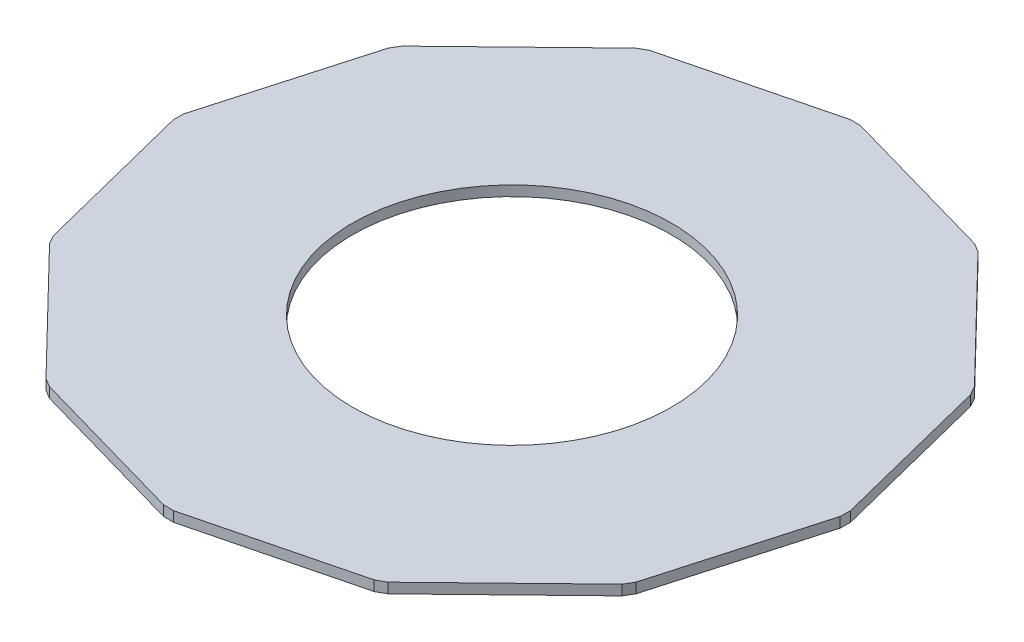
from build123d import *

# Parameters (mm, degrees)
SKETCH1_R           = 47.116713319
BOSS_EXTRUDE1_DEPTH = 3


with BuildPart() as part:
    # Sketch1 → Boss-Extrude1 (new body)
    with BuildSketch(Plane(origin=(0, 0, 0), x_dir=(1, 0, 0), z_dir=(0, 1, 0))):
        Polygon((-88.068159647, -47.370869281), (-99.999999495, 0.010045682), (-99.954698159, 3.009703627), (-86.597517101, 50.008699563), (-85.05845602, 52.583828878), (-49.991299932, 86.607562782), (-47.370869281, 88.068159647), (0.010045682, 99.999999495), (3.009703627, 99.954698159), (50.008699563, 86.597517101), (52.583828878, 85.05845602), (86.607562782, 49.991299932), (88.068159647, 47.370869281), (99.999999495, -0.010045682), (99.954698159, -3.009703627), (86.597517101, -50.008699563), (85.05845602, -52.583828878), (49.991299932, -86.607562782), (47.370869281, -88.068159647), (-0.010045682, -99.999999495), (-3.009703627, -99.954698159), (-50.008699563, -86.597517101), (-52.583828878, -85.05845602), (-86.607562782, -49.991299932), align=None)
        Circle(SKETCH1_R, mode=Mode.SUBTRACT)
    extrude(amount=BOSS_EXTRUDE1_DEPTH)


solid = part.part
